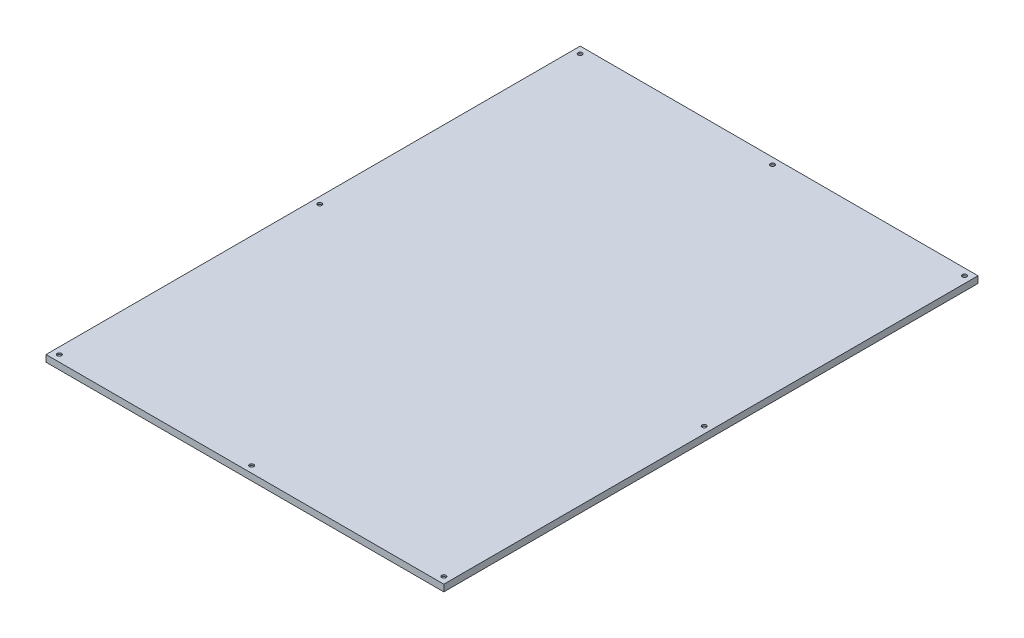
from build123d import *

# Parameters (mm, degrees)
SKETCH1_W           = 297.5
SKETCH1_H           = 399.5
BOSS_EXTRUDE1_DEPTH = 5
SKETCH2_R           = 1.6
CUT_EXTRUDE1_DEPTH  = 1.2


with BuildPart() as part:
    # Sketch1 → Boss-Extrude1 (new body)
    with BuildSketch(Plane(origin=(0, 0, 0), x_dir=(1, 0, 0), z_dir=(0, 1, 0))):
        with Locations((148.75, 199.75)):
            Rectangle(SKETCH1_W, SKETCH1_H)
    extrude(amount=BOSS_EXTRUDE1_DEPTH)

    # Sketch2 → Cut-Extrude1 (cut)
    with BuildSketch(Plane(origin=(0, 5, 0), x_dir=(1, 0, 0), z_dir=(0, 1, 0))):
        with Locations((292.5, 199.75)):
            Circle(SKETCH2_R)
        with Locations((292.5, 5)):
            Circle(SKETCH2_R)
        with Locations((148.75, 5)):
            Circle(SKETCH2_R)
        with Locations((5, 5)):
            Circle(SKETCH2_R)
        with Locations((5, 199.75)):
            Circle(SKETCH2_R)
        with Locations((292.5, 394.5)):
            Circle(SKETCH2_R)
        with Locations((148.75, 394.5)):
            Circle(SKETCH2_R)
        with Locations((5, 394.5)):
            Circle(SKETCH2_R)
    extrude(amount=-CUT_EXTRUDE1_DEPTH, mode=Mode.SUBTRACT)


solid = part.part
